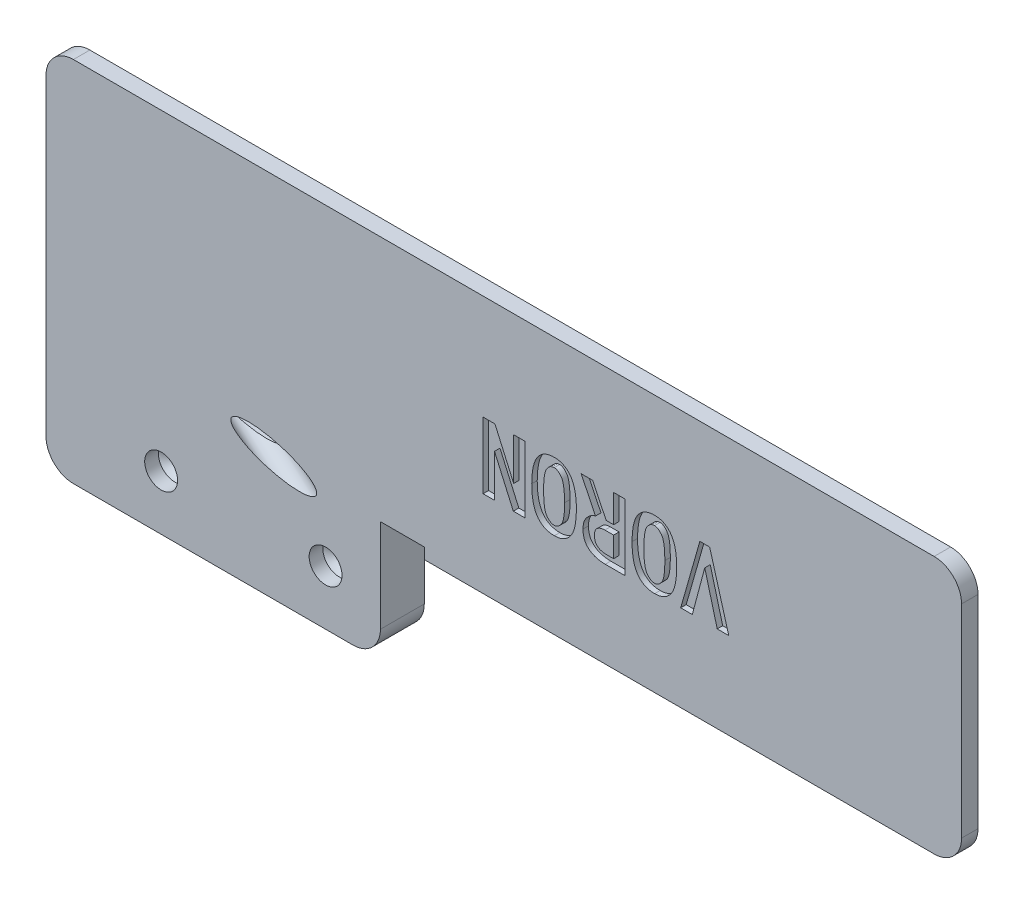
from build123d import *

# Parameters (mm, degrees)
BOSS_EXTRUDE1_DEPTH = 3
SKETCH2_W           = 61
SKETCH2_H           = 20
BOSS_EXTRUDE2_DEPTH = 5
SKETCH3_W           = 12
SKETCH3_H           = 7.5
CUT_EXTRUDE1_DEPTH  = 5
SKETCH4_R           = 1.75
CUT_EXTRUDE2_DEPTH  = 181.116628883
SKETCH5_R           = 3
CUT_EXTRUDE3_DEPTH  = 2.5
FILLET1_R           = 5
SKETCH9_R           = 2.5
CUT_EXTRUDE7_DEPTH  = 151.459657831
FILLET2_R           = 3
SKETCH10_W          = 8
SKETCH10_H          = 2
CUT_EXTRUDE8_DEPTH  = 181.116628883
CUT_EXTRUDE9_START  = -1
CUT_EXTRUDE9_DEPTH  = 1


# Read off the part's stored shape, not the designer's step: Cut-Extrude9
with BuildPart() as part:
    # Sketch1 → Boss-Extrude1 (new body)
    with BuildSketch(Plane.XY):
        Polygon((167, -47), (61, -47), (61, -67), (0, -67), (0, 0), (167, 0), align=None)
    extrude(amount=BOSS_EXTRUDE1_DEPTH)

    # Sketch2 → Boss-Extrude2 (add)
    with BuildSketch(Plane(origin=(0, 0, 0), x_dir=(-1, 0, 0), z_dir=(0, 0, -1))):
        with Locations((-30.5, -57)):
            Rectangle(SKETCH2_W, SKETCH2_H)
    extrude(amount=BOSS_EXTRUDE2_DEPTH)

    # Sketch3 → Cut-Extrude1 (cut)
    with BuildSketch(Plane(origin=(0, 0, -5), x_dir=(-1, 0, 0), z_dir=(0, 0, -1))):
        with Locations((-6, -50.75)):
            Rectangle(SKETCH3_W, SKETCH3_H)
    extrude(amount=-CUT_EXTRUDE1_DEPTH, mode=Mode.SUBTRACT)

    # Sketch4 → Cut-Extrude2 (cut, through all)
    with BuildSketch(Plane.XY.offset(3)):
        with Locations((51, -57)):
            Circle(SKETCH4_R)
        with Locations((21, -57)):
            Circle(SKETCH4_R)
    extrude(amount=-CUT_EXTRUDE2_DEPTH, mode=Mode.SUBTRACT)

    # Sketch5 → Cut-Extrude3 (cut)
    with BuildSketch(Plane.XY.offset(3)):
        with Locations((51, -57)):
            Circle(SKETCH5_R)
        with Locations((21, -57)):
            Circle(SKETCH5_R)
    extrude(amount=-CUT_EXTRUDE3_DEPTH, mode=Mode.SUBTRACT)

    # Fillet1
    fillet1_edges = [part.edges().sort_by_distance(p)[0] for p in [
        (0, 0, 1.5),
        (167, 0, 1.5),
        (167, -47, 1.5),
        (61, -67, -1),
        (0, -67, -1),
    ]]
    fillet(fillet1_edges, radius=FILLET1_R)

    # Sketch9 → Cut-Extrude7 (cut, through all)
    with BuildSketch(Plane(origin=(136.7313304, -36.637049561, 45.993906706), x_dir=(-0.25881904510251724, -0.9659258262890693, 0), z_dir=(-0.9186500513499987, 0.24615153938603795, -0.30901699437495145))):
        with Locations(Location((32.177320727, -13.100549595, 0), (0, 0, 270))):
            Circle(SKETCH9_R)
    extrude(amount=CUT_EXTRUDE7_DEPTH, mode=Mode.SUBTRACT)

    # Fillet2
    # the kernel refuses this fillet: 3 mm, written as the material it takes off along each edge
    with BuildSketch(Plane(origin=(51, -57, 0.5), x_dir=(1, 0, 0), z_dir=(0, -1, 0))) as fillet2_piece_1:
        with BuildLine():
            CenterArc((4.75, -2.436698586), FILLET2_R, 125.685334713, 54.314665287)
            Line((3, 0), (2.965, 0.048733972))
            ThreePointArc((2.965, 0.048733972), (2.375, 0.06), (1.75, 0.06))
            Line((1.75, 0.06), (1.69, 0))
            Line((1.69, 0), (1.69, -2.436698586))
            Line((1.69, -2.436698586), (1.75, -2.436698586))
        make_face()
    revolve(axis=Axis((51, -57, 0.5), (0, 0, 1)), mode=Mode.SUBTRACT)
    with BuildSketch(Plane(origin=(21, -57, 0.5), x_dir=(1, 0, 0), z_dir=(0, -1, 0))) as fillet2_piece_2:
        with BuildLine():
            CenterArc((4.75, -2.436698586), FILLET2_R, 125.685334713, 54.314665287)
            Line((3, 0), (2.965, 0.048733972))
            ThreePointArc((2.965, 0.048733972), (2.375, 0.06), (1.75, 0.06))
            Line((1.75, 0.06), (1.69, 0))
            Line((1.69, 0), (1.69, -2.436698586))
            Line((1.69, -2.436698586), (1.75, -2.436698586))
        make_face()
    revolve(axis=Axis((21, -57, 0.5), (0, 0, 1)), mode=Mode.SUBTRACT)

    # Sketch10 → Cut-Extrude8 (cut, through all)
    with BuildSketch(Plane.XY.offset(3)):
        with Locations((65, -46)):
            Rectangle(SKETCH10_W, SKETCH10_H)
    extrude(amount=-CUT_EXTRUDE8_DEPTH, mode=Mode.SUBTRACT)

    # Cut-Extrude9 outline → Cut-Extrude9 (cut)
    # profile 1 of 5: a face of its own
    with BuildSketch(Plane.XY.offset(3).offset(CUT_EXTRUDE9_START)):
        with BuildLine():
            add(Edge.make_bspline(
                [(111.018114202, -31.366880646), (110.855876481, -31.362361001), (110.53946573, -31.35354638), (110.079717624, -31.285838932), (109.649990932, -31.170880938), (109.248584332, -31.012172126), (108.876559724, -30.805973917), (108.536536789, -30.550567763), (108.225453404, -30.252517836), (107.943947228, -29.907819796), (107.695748165, -29.510466662), (107.480926025, -29.05849142), (107.299822959, -28.55142934), (107.153363478, -27.989239655), (107.037122747, -27.372700341), (106.955881358, -26.700714752), (106.906040081, -25.973663667), (106.901111308, -25.470496456), (106.898556047, -25.209635681)],
                knots=[0, 0, 0, 0, 0.057798204, 0.112723311, 0.165144603, 0.215995104, 0.26616156, 0.316236738, 0.367112535, 0.419331621, 0.474407491, 0.533645497, 0.597317521, 0.665986224, 0.74046104, 0.820722145, 0.907055628, 1, 1, 1, 1], degree=3))
            add(Edge.make_bspline(
                [(115.041506015, -25.209635681), (115.039279499, -25.474847009), (115.034989081, -25.985899973), (114.980923156, -26.72313575), (114.900484509, -27.402084281), (114.785600334, -28.023874436), (114.631942473, -28.586693304), (114.449936346, -29.093771453), (114.23164728, -29.542771111), (113.977714602, -29.933553251), (113.694005625, -30.272170596), (113.385920905, -30.564812277), (113.054270487, -30.815432015), (112.693679654, -31.015838262), (112.310632089, -31.176030746), (111.901010454, -31.287857216), (111.467239942, -31.352752451), (111.169948341, -31.362104383), (111.018114202, -31.366880646)],
                knots=[0, 0, 0, 0, 0.095508934, 0.18404238, 0.266100108, 0.34168647, 0.4115609, 0.476027689, 0.535480784, 0.590962687, 0.643464062, 0.694233186, 0.743726055, 0.79276826, 0.842433976, 0.892930954, 0.945317203, 1, 1, 1, 1], degree=3))
            add(Edge.make_bspline(
                [(111.018114202, -18.982215278), (111.170845756, -18.986715927), (111.469196913, -18.995507652), (111.903785777, -19.063946363), (112.313293282, -19.178420106), (112.697143597, -19.340673127), (113.056929129, -19.547104785), (113.389510534, -19.802610831), (113.696635826, -20.103342008), (113.980377664, -20.44959831), (114.234328825, -20.848156975), (114.451725293, -21.304292016), (114.635330445, -21.816590981), (114.784628483, -22.38554719), (114.900524934, -23.011098813), (114.980868047, -23.693561066), (115.034937101, -24.43250487), (115.039264236, -24.944423627), (115.041506015, -25.209635681)],
                knots=[0, 0, 0, 0, 0.054634439, 0.106724824, 0.156974504, 0.206434745, 0.255462678, 0.305005436, 0.356086938, 0.408961121, 0.464861566, 0.524761641, 0.58938903, 0.659324006, 0.735024887, 0.816853165, 0.905116295, 1, 1, 1, 1], degree=3))
            add(Edge.make_bspline(
                [(106.898556047, -25.209635681), (106.901124955, -24.947911855), (106.906080639, -24.443020136), (106.955814637, -23.712475993), (107.037792042, -23.037346247), (107.150424824, -22.416008058), (107.297193046, -21.849646973), (107.478973028, -21.338224999), (107.690537526, -20.879117225), (107.939786624, -20.475354642), (108.21837605, -20.120476853), (108.531368686, -19.817030953), (108.871129571, -19.556385253), (109.242564976, -19.344427341), (109.645446593, -19.183023743), (110.076194905, -19.06636052), (110.537491774, -18.994634885), (110.854972281, -18.986430975), (111.018114202, -18.982215278)],
                knots=[0, 0, 0, 0, 0.092625035, 0.178683057, 0.259012316, 0.333230519, 0.402029772, 0.465850231, 0.525112086, 0.580597868, 0.633420957, 0.684380321, 0.734487449, 0.784617092, 0.835239512, 0.887683859, 0.942284737, 1, 1, 1, 1], degree=3))
        make_face()
        with BuildLine():
            add(Edge.make_bspline(
                [(111.018114202, -20.622241269), (110.952016296, -20.624403246), (110.821062735, -20.628686566), (110.628986288, -20.673470171), (110.442709952, -20.740116548), (110.265245146, -20.838393517), (110.094245482, -20.962328523), (109.930972118, -21.113889496), (109.774547706, -21.292500107), (109.622030793, -21.500745663), (109.48502385, -21.756874294), (109.366095622, -22.069155875), (109.271289846, -22.44387111), (109.187407989, -22.878396666), (109.129127302, -23.375433897), (109.080987863, -23.932657018), (109.057561554, -24.551006135), (109.052992031, -24.983502588), (109.050602831, -25.209635681)],
                knots=[0, 0, 0, 0, 0.035941305, 0.071207126, 0.106887262, 0.143418514, 0.18127, 0.221679479, 0.264473585, 0.310443692, 0.361964248, 0.422168836, 0.49199128, 0.572230923, 0.66307101, 0.764412447, 0.876821783, 1, 1, 1, 1], degree=3))
            add(Edge.make_bspline(
                [(112.889459231, -25.209635681), (112.88711021, -24.979167709), (112.882631351, -24.539736236), (112.858859251, -23.912768505), (112.811902273, -23.350093914), (112.749937725, -22.849754529), (112.66412408, -22.413328582), (112.566399683, -22.038651205), (112.445986006, -21.727723792), (112.30249098, -21.477275678), (112.147209368, -21.276424027), (111.996610963, -21.101292841), (111.840170884, -20.955518121), (111.681330332, -20.834277816), (111.519630259, -20.740348031), (111.356323841, -20.669868271), (111.188104844, -20.630017047), (111.074621068, -20.624826028), (111.018114202, -20.622241269)],
                knots=[0, 0, 0, 0, 0.127589257, 0.243273436, 0.347227119, 0.440088535, 0.522201836, 0.593290181, 0.654207522, 0.706199851, 0.752433837, 0.794573594, 0.833936252, 0.870578172, 0.904962848, 0.937207121, 0.968733603, 1, 1, 1, 1], degree=3))
            add(Edge.make_bspline(
                [(111.018114202, -29.726854655), (111.074679348, -29.724416715), (111.188280169, -29.719520557), (111.355765789, -29.677387397), (111.52235031, -29.615894365), (111.682777627, -29.521960169), (111.842945548, -29.408134142), (111.995624601, -29.264412998), (112.150398692, -29.10025805), (112.304632771, -28.905642425), (112.450192002, -28.663403241), (112.564126765, -28.356816574), (112.6693894, -27.990676593), (112.748348787, -27.558602147), (112.812780495, -27.062413026), (112.858535781, -26.502120904), (112.882720882, -25.876951642), (112.887140734, -25.439242431), (112.889459231, -25.209635681)],
                knots=[0, 0, 0, 0, 0.031585961, 0.063434664, 0.096098454, 0.130593821, 0.167035025, 0.205786461, 0.247605858, 0.293159778, 0.344428261, 0.404888774, 0.475433988, 0.557342821, 0.650192526, 0.755208686, 0.871591146, 1, 1, 1, 1], degree=3))
            add(Edge.make_bspline(
                [(109.050602831, -25.209635681), (109.051375061, -25.435803149), (109.052849219, -25.867548583), (109.083492293, -26.483714091), (109.12386812, -27.038271379), (109.189557662, -27.529881193), (109.267149358, -27.959474802), (109.364244077, -28.327468306), (109.481568848, -28.633524256), (109.619487708, -28.882437262), (109.771796108, -29.083067509), (109.92937836, -29.253531025), (110.091794961, -29.40118285), (110.265783332, -29.517639406), (110.442080298, -29.613770944), (110.628034444, -29.679333035), (110.82057972, -29.719415275), (110.952078826, -29.724367685), (111.018114202, -29.726854655)],
                knots=[0, 0, 0, 0, 0.124389335, 0.237454696, 0.33928391, 0.430137535, 0.510145031, 0.579276867, 0.639188506, 0.689965767, 0.735238588, 0.77739427, 0.81756373, 0.855631578, 0.892298529, 0.927721101, 0.963703447, 1, 1, 1, 1], degree=3))
        make_face(mode=Mode.SUBTRACT)
    # profile 2 of 5: a face of its own
    with BuildSketch(Plane.XY.offset(3).offset(CUT_EXTRUDE9_START)):
        with BuildLine():
            add(Edge.make_bspline(
                [(102.007068068, -31.229128859), (101.860544878, -31.226959131), (101.572945861, -31.222700342), (101.152680902, -31.179774298), (100.752988212, -31.113025179), (100.37501357, -31.019200233), (100.017376689, -30.901233107), (99.682784959, -30.750592123), (99.367054358, -30.577800541), (99.075076176, -30.375066616), (98.811146801, -30.14360156), (98.579342772, -29.882032407), (98.387035514, -29.587597781), (98.226968774, -29.266090158), (98.105333891, -28.913736624), (98.017034617, -28.532332073), (97.965515231, -28.120287945), (97.958631644, -27.835729358), (97.955086262, -27.689167845)],
                knots=[0, 0, 0, 0, 0.07177648, 0.140884493, 0.206768315, 0.27019358, 0.331544729, 0.391028542, 0.449745419, 0.507686765, 0.56483575, 0.621385571, 0.678373497, 0.73665908, 0.796943429, 0.860582866, 0.928193395, 1, 1, 1, 1], degree=3))
            Line((102.007068068, -31.229128859), (105.61720452, -31.229128859))
            Line((105.61720452, -31.229128859), (105.61720452, -19.119967065))
            Line((105.61720452, -19.119967065), (103.535333175, -19.119967065))
            Line((103.535333175, -19.119967065), (103.535333175, -24.21678318))
            Line((103.535333175, -24.21678318), (102.18120712, -24.21678318))
            Line((102.18120712, -24.21678318), (99.701674956, -19.119967065))
            Line((99.701674956, -19.119967065), (97.61200634, -19.119967065))
            Line((97.61200634, -19.119967065), (100.22929029, -24.494885844))
            add(Edge.make_bspline(
                [(97.955086262, -27.689167845), (97.956427965, -27.575548087), (97.959036978, -27.354608384), (97.998210153, -27.032560677), (98.053524231, -26.727928379), (98.133660765, -26.441318401), (98.238771577, -26.173413131), (98.365680385, -25.924352604), (98.515071627, -25.691547652), (98.743658635, -25.417209005), (99.047146251, -25.117524558), (99.428944468, -24.825469808), (99.821267468, -24.610026797), (100.095775339, -24.532562753), (100.22929029, -24.494885844)],
                knots=[0, 0, 0, 0, 0.080422873, 0.156386584, 0.229439376, 0.299567811, 0.36679871, 0.432936994, 0.497274473, 0.562252548, 0.685483567, 0.798514642, 0.902001689, 1, 1, 1, 1], degree=3))
        make_face()
        with BuildLine():
            add(Edge.make_bspline(
                [(101.93949172, -25.856809171), (101.814364184, -25.861783414), (101.570389166, -25.871482248), (101.21786722, -25.94761707), (100.89259009, -26.077677134), (100.64419245, -26.225943931), (100.464932187, -26.372222534), (100.353234928, -26.506783716), (100.251504522, -26.654225116), (100.176154768, -26.826267224), (100.111079373, -27.014218505), (100.073829368, -27.223796071), (100.041767372, -27.449949134), (100.040310569, -27.607590771), (100.039556697, -27.689167845)],
                knots=[0, 0, 0, 0, 0.124536252, 0.242822127, 0.357051969, 0.472019025, 0.529572112, 0.58646832, 0.645571914, 0.707335934, 0.772814605, 0.843202062, 0.918859527, 1, 1, 1, 1], degree=3))
            Line((101.93949172, -25.856809171), (103.535333175, -25.856809171))
            Line((103.535333175, -25.856809171), (103.535333175, -29.589102868))
            Line((103.535333175, -29.589102868), (102.352747081, -29.589102868))
            add(Edge.make_bspline(
                [(100.039556697, -27.689167845), (100.040762809, -27.761161591), (100.043125313, -27.902181233), (100.070082803, -28.107384941), (100.111739412, -28.301237317), (100.167700872, -28.484128093), (100.24419967, -28.653411825), (100.334770699, -28.811606415), (100.446257773, -28.954388616), (100.570068773, -29.089635625), (100.718679423, -29.206266623), (100.885365014, -29.312210152), (101.077095662, -29.3965127), (101.289759716, -29.466207972), (101.524003153, -29.524337484), (101.781724453, -29.561132017), (102.060323761, -29.585118284), (102.253059673, -29.587744519), (102.352747081, -29.589102868)],
                knots=[0, 0, 0, 0, 0.062936569, 0.123278658, 0.180649941, 0.236252399, 0.290187819, 0.342824697, 0.395264843, 0.448336295, 0.502775077, 0.559965915, 0.620673271, 0.685373413, 0.755581368, 0.831457523, 0.912825988, 1, 1, 1, 1], degree=3))
        make_face(mode=Mode.SUBTRACT)
    # profile 3 of 5: a face of its own
    with BuildSketch(Plane.XY.offset(3).offset(CUT_EXTRUDE9_START)):
        with BuildLine():
            add(Edge.make_bspline(
                [(92.720518361, -31.366880646), (92.558280639, -31.362361001), (92.241869888, -31.35354638), (91.782121783, -31.285838932), (91.35239509, -31.170880938), (90.950988491, -31.012172126), (90.578963883, -30.805973917), (90.238940948, -30.550567763), (89.927857563, -30.252517836), (89.646351387, -29.907819796), (89.398152324, -29.510466662), (89.183330183, -29.05849142), (89.002227118, -28.55142934), (88.855767637, -27.989239655), (88.739526905, -27.372700341), (88.658285516, -26.700714752), (88.60844424, -25.973663667), (88.603515467, -25.470496456), (88.600960206, -25.209635681)],
                knots=[0, 0, 0, 0, 0.057798204, 0.112723311, 0.165144603, 0.215995104, 0.26616156, 0.316236738, 0.367112535, 0.419331621, 0.474407491, 0.533645497, 0.597317521, 0.665986224, 0.74046104, 0.820722145, 0.907055628, 1, 1, 1, 1], degree=3))
            add(Edge.make_bspline(
                [(96.743910173, -25.209635681), (96.741683658, -25.474847009), (96.73739324, -25.985899973), (96.683327315, -26.72313575), (96.602888667, -27.402084281), (96.488004492, -28.023874436), (96.334346631, -28.586693304), (96.152340504, -29.093771453), (95.934051438, -29.542771111), (95.680118761, -29.933553251), (95.396409784, -30.272170596), (95.088325064, -30.564812277), (94.756674646, -30.815432015), (94.396083813, -31.015838262), (94.013036247, -31.176030746), (93.603414612, -31.287857216), (93.169644101, -31.352752451), (92.872352499, -31.362104383), (92.720518361, -31.366880646)],
                knots=[0, 0, 0, 0, 0.095508934, 0.18404238, 0.266100108, 0.34168647, 0.4115609, 0.476027689, 0.535480784, 0.590962687, 0.643464062, 0.694233186, 0.743726055, 0.79276826, 0.842433976, 0.892930954, 0.945317203, 1, 1, 1, 1], degree=3))
            add(Edge.make_bspline(
                [(92.720518361, -18.982215278), (92.873249915, -18.986715927), (93.171601072, -18.995507652), (93.606189936, -19.063946363), (94.015697441, -19.178420106), (94.399547755, -19.340673127), (94.759333288, -19.547104785), (95.091914693, -19.802610831), (95.399039985, -20.103342008), (95.682781822, -20.44959831), (95.936732984, -20.848156975), (96.154129451, -21.304292016), (96.337734603, -21.816590981), (96.487032642, -22.38554719), (96.602929093, -23.011098813), (96.683272205, -23.693561066), (96.737341259, -24.43250487), (96.741668395, -24.944423627), (96.743910173, -25.209635681)],
                knots=[0, 0, 0, 0, 0.054634439, 0.106724824, 0.156974504, 0.206434745, 0.255462678, 0.305005436, 0.356086938, 0.408961121, 0.464861566, 0.524761641, 0.58938903, 0.659324006, 0.735024887, 0.816853165, 0.905116295, 1, 1, 1, 1], degree=3))
            add(Edge.make_bspline(
                [(88.600960206, -25.209635681), (88.603529114, -24.947911855), (88.608484797, -24.443020136), (88.658218796, -23.712475993), (88.740196201, -23.037346247), (88.852828982, -22.416008058), (88.999597205, -21.849646973), (89.181377186, -21.338224999), (89.392941685, -20.879117225), (89.642190783, -20.475354642), (89.920780208, -20.120476853), (90.233772845, -19.817030953), (90.57353373, -19.556385253), (90.944969135, -19.344427341), (91.347850751, -19.183023743), (91.778599064, -19.06636052), (92.239895932, -18.994634885), (92.55737644, -18.986430975), (92.720518361, -18.982215278)],
                knots=[0, 0, 0, 0, 0.092625035, 0.178683057, 0.259012316, 0.333230519, 0.402029772, 0.465850231, 0.525112086, 0.580597868, 0.633420957, 0.684380321, 0.734487449, 0.784617092, 0.835239512, 0.887683859, 0.942284737, 1, 1, 1, 1], degree=3))
        make_face()
        with BuildLine():
            add(Edge.make_bspline(
                [(92.720518361, -20.622241269), (92.654420455, -20.624403246), (92.523466894, -20.628686566), (92.331390446, -20.673470171), (92.145114111, -20.740116548), (91.967649304, -20.838393517), (91.79664964, -20.962328523), (91.633376276, -21.113889496), (91.476951864, -21.292500107), (91.324434952, -21.500745663), (91.187428009, -21.756874294), (91.068499781, -22.069155875), (90.973694005, -22.44387111), (90.889812148, -22.878396666), (90.831531461, -23.375433897), (90.783392021, -23.932657018), (90.759965713, -24.551006135), (90.755396189, -24.983502588), (90.75300699, -25.209635681)],
                knots=[0, 0, 0, 0, 0.035941305, 0.071207126, 0.106887262, 0.143418514, 0.18127, 0.221679479, 0.264473585, 0.310443692, 0.361964248, 0.422168836, 0.49199128, 0.572230923, 0.66307101, 0.764412447, 0.876821783, 1, 1, 1, 1], degree=3))
            add(Edge.make_bspline(
                [(94.59186339, -25.209635681), (94.589514369, -24.979167709), (94.58503551, -24.539736236), (94.56126341, -23.912768505), (94.514306431, -23.350093914), (94.452341884, -22.849754529), (94.366528239, -22.413328582), (94.268803841, -22.038651205), (94.148390164, -21.727723792), (94.004895139, -21.477275678), (93.849613527, -21.276424027), (93.699015122, -21.101292841), (93.542575043, -20.955518121), (93.383734491, -20.834277816), (93.222034418, -20.740348031), (93.058728, -20.669868271), (92.890509003, -20.630017047), (92.777025227, -20.624826028), (92.720518361, -20.622241269)],
                knots=[0, 0, 0, 0, 0.127589257, 0.243273436, 0.347227119, 0.440088535, 0.522201836, 0.593290181, 0.654207522, 0.706199851, 0.752433837, 0.794573594, 0.833936252, 0.870578172, 0.904962848, 0.937207121, 0.968733603, 1, 1, 1, 1], degree=3))
            add(Edge.make_bspline(
                [(92.720518361, -29.726854655), (92.777083507, -29.724416715), (92.890684328, -29.719520557), (93.058169948, -29.677387397), (93.224754469, -29.615894365), (93.385181786, -29.521960169), (93.545349707, -29.408134142), (93.69802876, -29.264412998), (93.85280285, -29.10025805), (94.007036929, -28.905642425), (94.15259616, -28.663403241), (94.266530923, -28.356816574), (94.371793559, -27.990676593), (94.450752946, -27.558602147), (94.515184653, -27.062413026), (94.56093994, -26.502120904), (94.58512504, -25.876951642), (94.589544892, -25.439242431), (94.59186339, -25.209635681)],
                knots=[0, 0, 0, 0, 0.031585961, 0.063434664, 0.096098454, 0.130593821, 0.167035025, 0.205786461, 0.247605858, 0.293159778, 0.344428261, 0.404888774, 0.475433988, 0.557342821, 0.650192526, 0.755208686, 0.871591146, 1, 1, 1, 1], degree=3))
            add(Edge.make_bspline(
                [(90.75300699, -25.209635681), (90.753779219, -25.435803149), (90.755253378, -25.867548583), (90.785896451, -26.483714091), (90.826272279, -27.038271379), (90.89196182, -27.529881193), (90.969553516, -27.959474802), (91.066648235, -28.327468306), (91.183973007, -28.633524256), (91.321891866, -28.882437262), (91.474200266, -29.083067509), (91.631782519, -29.253531025), (91.79419912, -29.40118285), (91.968187491, -29.517639406), (92.144484456, -29.613770944), (92.330438603, -29.679333035), (92.522983879, -29.719415275), (92.654482984, -29.724367685), (92.720518361, -29.726854655)],
                knots=[0, 0, 0, 0, 0.124389335, 0.237454696, 0.33928391, 0.430137535, 0.510145031, 0.579276867, 0.639188506, 0.689965767, 0.735238588, 0.77739427, 0.81756373, 0.855631578, 0.892298529, 0.927721101, 0.963703447, 1, 1, 1, 1], degree=3))
        make_face(mode=Mode.SUBTRACT)
    # profile 4 of 5: a face of its own
    with BuildSketch(Plane.XY.offset(3).offset(CUT_EXTRUDE9_START)):
        Polygon((79.727665859, -19.119967065), (79.727665859, -31.229128859), (81.809537204, -31.229128859), (81.809537204, -23.485719903), (85.242935515, -31.229128859), (87.389784118, -31.229128859), (87.389784118, -19.119967065), (85.305313682, -19.119967065), (85.305313682, -26.817060737), (81.890109004, -19.119967065), align=None)
    # profile 5 of 5: a face of its own
    with BuildSketch(Plane.XY.offset(3).offset(CUT_EXTRUDE9_START)):
        Polygon((115.771850394, -31.229128859), (117.884910823, -31.229128859), (120.157888866, -22.718334052), (122.43331888, -31.229128859), (124.535982948, -31.229128859), (121.053201921, -18.982215278), (119.265027782, -18.982215278), align=None)
    extrude(amount=CUT_EXTRUDE9_DEPTH, mode=Mode.SUBTRACT)


solid = part.part
